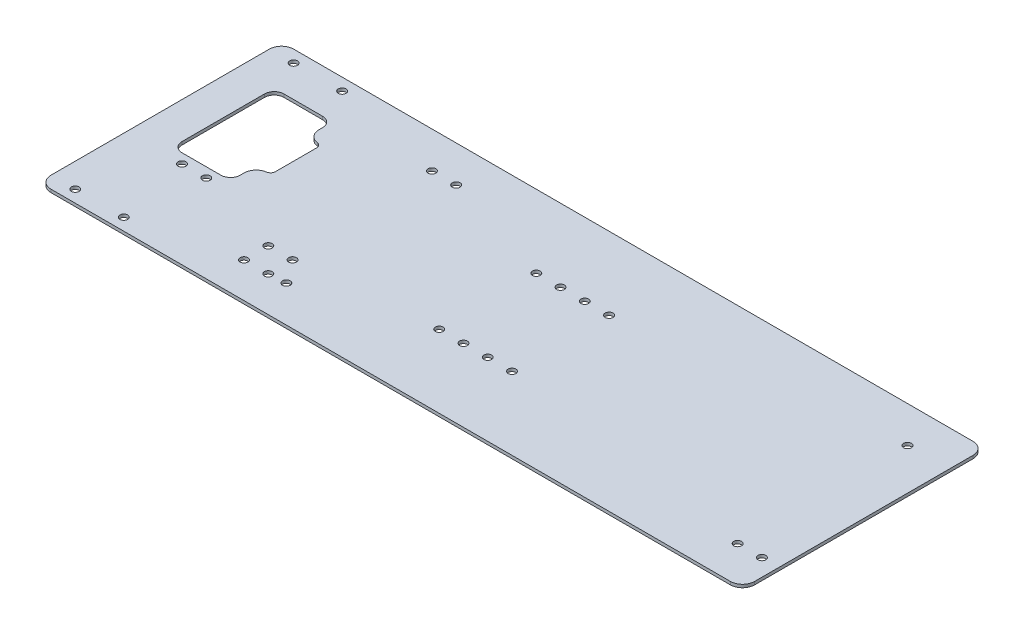
from build123d import *

# Parameters (mm, degrees)
SKETCH1_W           = 368.3
SKETCH1_H           = 127
SKETCH1_R           = 2.032
BOSS_EXTRUDE1_DEPTH = 1.5875
FILLET1_R           = 5.08
FILLET3_R           = 6.35
FILLET4_R           = 2.54
FILLET5_R           = 6.35
SKETCH3_R           = 2.032
CUT_EXTRUDE5_DEPTH  = 195.797311855


with BuildPart() as part:
    # Sketch1 → Boss-Extrude1 (new body)
    with BuildSketch(Plane(origin=(0, 0, 0), x_dir=(1, 0, 0), z_dir=(0, 1, 0))):
        Rectangle(SKETCH1_W, SKETCH1_H)
        with Locations((-171.45, -57.15)):
            Circle(SKETCH1_R, mode=Mode.SUBTRACT)
        with Locations((-146.05, -57.15)):
            Circle(SKETCH1_R, mode=Mode.SUBTRACT)
        with Locations((-95.25, -45.0215)):
            Circle(SKETCH1_R, mode=Mode.SUBTRACT)
        with Locations((-95.25, -32.3215)):
            Circle(SKETCH1_R, mode=Mode.SUBTRACT)
        with Locations((-82.55, -45.0215)):
            Circle(SKETCH1_R, mode=Mode.SUBTRACT)
        with Locations((-82.55, -32.3215)):
            Circle(SKETCH1_R, mode=Mode.SUBTRACT)
        with Locations((-154.94, -17.78)):
            Circle(SKETCH1_R, mode=Mode.SUBTRACT)
        with Locations((-142.24, -17.78)):
            Circle(SKETCH1_R, mode=Mode.SUBTRACT)
        Polygon((-134.62, -12.7), (-165.1, -12.7), (-165.1, 40.64), (-134.62, 40.64), (-134.62, 27.305), (-127, 27.305), (-127, 0.635), (-134.62, 0.635), align=None, mode=Mode.SUBTRACT)
        with Locations((-171.45, 57.15)):
            Circle(SKETCH1_R, mode=Mode.SUBTRACT)
        with Locations((-146.05, 57.15)):
            Circle(SKETCH1_R, mode=Mode.SUBTRACT)
    extrude(amount=BOSS_EXTRUDE1_DEPTH)

    # Fillet1
    fillet1_edges = [part.edges().sort_by_distance(p)[0] for p in [
        (-134.62, 0.79375, 12.7),
        (-165.1, 0.79375, 12.7),
        (-165.1, 0.79375, -40.64),
        (-134.62, 0.79375, -40.64),
    ]]
    fillet(fillet1_edges, radius=FILLET1_R)

    # Fillet3
    fillet3_edges = [part.edges().sort_by_distance(p)[0] for p in [
        (184.15, 0.79375, 63.5),
        (184.15, 0.79375, -63.5),
        (-184.15, 0.79375, 63.5),
        (-184.15, 0.79375, -63.5),
    ]]
    fillet(fillet3_edges, radius=FILLET3_R)

    # Fillet4
    fillet4_edges = [part.edges().sort_by_distance(p)[0] for p in [
        (-127, 0.79375, -0.635),
        (-127, 0.79375, -27.305),
    ]]
    fillet(fillet4_edges, radius=FILLET4_R)

    # Fillet5
    fillet5_edges = [part.edges().sort_by_distance(p)[0] for p in [
        (-134.62, 0.79375, -0.635),
        (-134.62, 0.79375, -27.305),
    ]]
    fillet(fillet5_edges, radius=FILLET5_R)

    # Sketch3 → Cut-Extrude5 (cut, through all)
    with BuildSketch(Plane(origin=(0, 1.5875, 0), x_dir=(1, 0, 0), z_dir=(0, 1, 0))):
        with Locations((-12.7, -25.4)):
            Circle(SKETCH3_R)
        with Locations((0, -25.4)):
            Circle(SKETCH3_R)
        with Locations((12.7, -25.4)):
            Circle(SKETCH3_R)
        with Locations((25.4, -25.4)):
            Circle(SKETCH3_R)
        with Locations((25.4, 25.4)):
            Circle(SKETCH3_R)
        with Locations((12.7, 25.4)):
            Circle(SKETCH3_R)
        with Locations((0, 25.4)):
            Circle(SKETCH3_R)
        with Locations((-12.7, 25.4)):
            Circle(SKETCH3_R)
        with Locations((175.26, -44.45)):
            Circle(SKETCH3_R)
        with Locations((162.56, -44.45)):
            Circle(SKETCH3_R)
        with Locations((162.56, 44.45)):
            Circle(SKETCH3_R)
        with Locations((-73.66, 44.45)):
            Circle(SKETCH3_R)
        with Locations((-86.36, 44.45)):
            Circle(SKETCH3_R)
        with Locations((-73.66, -44.45)):
            Circle(SKETCH3_R)
    extrude(amount=-CUT_EXTRUDE5_DEPTH, mode=Mode.SUBTRACT)


solid = part.part
